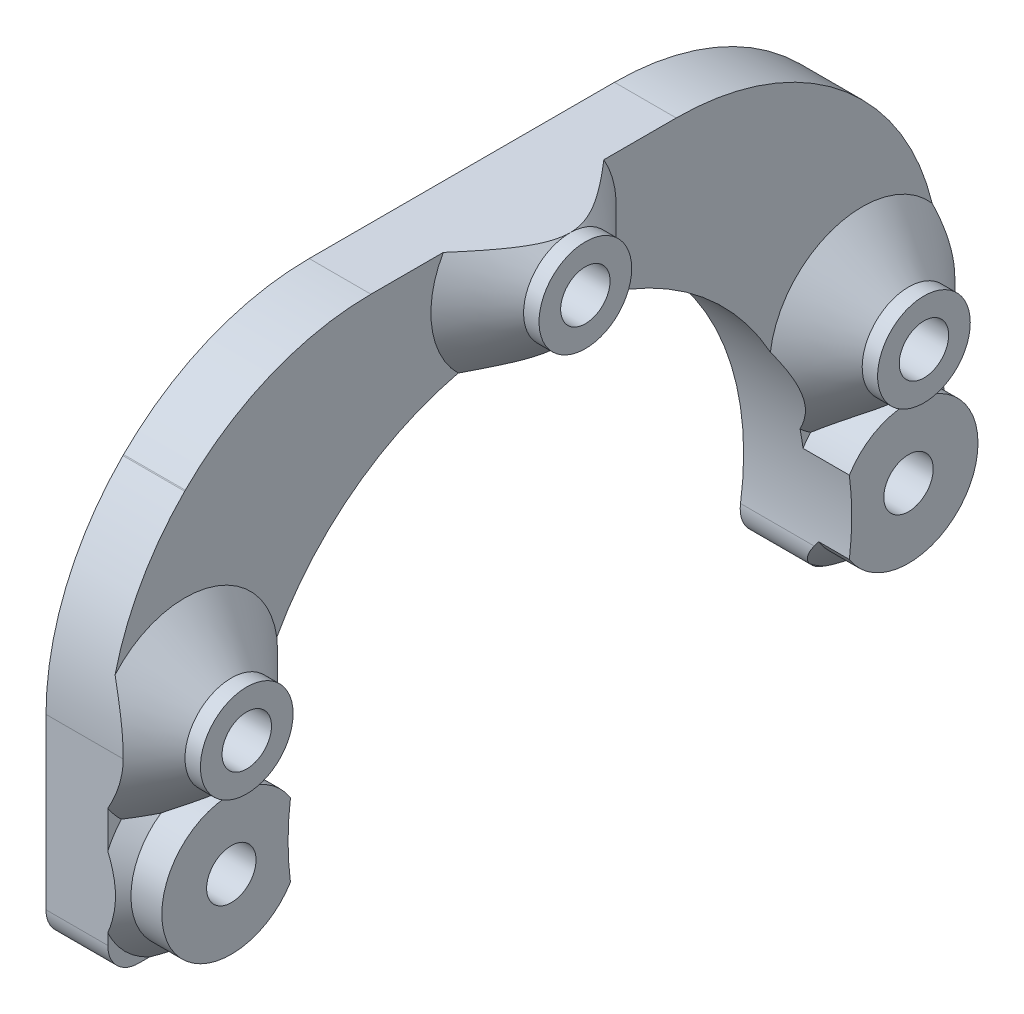
from build123d import *

# Parameters (mm, degrees)
SKETCH_1_W               = 53.85
SKETCH_1_H               = 30
SKETCH_1_R               = 1.6
EXTRUDE_1_DEPTH          = 4
SKETCH_7_R               = 4.5
SKETCH_7_R_2             = 1.6
EXTRUDE_3_DEPTH          = 3
CUT_EXTRUDE_1_DEPTH      = 62.772344136
CUT_EXTRUDE_1_DEPTH_BACK = 4
SKETCH_2_R               = 18.25
CHAMFER_1_SIZE           = 10
SKETCH_3_R               = 3
EXTRUDE_2_DEPTH          = 4
SKETCH_4_R               = 1.6
CUT_EXTRUDE_2_DEPTH      = 63.159653313
CHAMFER_3_SIZE           = 3
CHAMFER_4_SIZE           = 1
FILLET_1_R               = 2
FILLET_2_R               = 17


with BuildPart() as part:
    # 草图1 → 凸台-拉伸1 (new body)
    with BuildSketch(Plane(origin=(0, 0, 0), x_dir=(0, 0, -1), z_dir=(1, 0, 0))):
        with Locations((26.925, -15)):
            Rectangle(SKETCH_1_W, SKETCH_1_H)
        with Locations((5, -25)):
            Circle(SKETCH_1_R, mode=Mode.SUBTRACT)
        with Locations((48.85, -25)):
            Circle(SKETCH_1_R, mode=Mode.SUBTRACT)
    extrude(amount=EXTRUDE_1_DEPTH)

    # 草图7 → 凸台-拉伸3 (add)
    # profile 1 of 2: a face of its own
    with BuildSketch(Plane(origin=(4, 0, 0), x_dir=(0, 0, -1), z_dir=(1, 0, 0))):
        with Locations((5, -25)):
            Circle(SKETCH_7_R)
        with Locations((5, -25)):
            Circle(SKETCH_7_R_2, mode=Mode.SUBTRACT)
    # profile 2 of 2: a face of its own
    with BuildSketch(Plane(origin=(4, 0, 0), x_dir=(0, 0, -1), z_dir=(1, 0, 0))):
        with Locations((48.85, -25)):
            Circle(SKETCH_7_R)
        with Locations((48.85, -25)):
            Circle(SKETCH_7_R_2, mode=Mode.SUBTRACT)
    extrude(amount=EXTRUDE_3_DEPTH)

    # 草图2 → 切除-拉伸1 (cut, two sides: drawn at the far end of the back side and taken through both)
    with BuildSketch(Plane(origin=(4, 0, 0), x_dir=(0, 0, -1), z_dir=(1, 0, 0)).offset(-CUT_EXTRUDE_1_DEPTH_BACK)):
        with Locations((26.925, -25)):
            Circle(SKETCH_2_R)
    extrude(amount=CUT_EXTRUDE_1_DEPTH + CUT_EXTRUDE_1_DEPTH_BACK, mode=Mode.SUBTRACT)

    # 倒角1
    chamfer_1_edges = [part.edges().sort_by_distance(p)[0] for p in [
        (2, 0, 0),
        (2, 0, -53.85),
    ]]
    chamfer(chamfer_1_edges, length=CHAMFER_1_SIZE)

    # 草图3 → 凸台-拉伸2 (add)
    with BuildSketch(Plane(origin=(4, 0, 0), x_dir=(0, 0, -1), z_dir=(1, 0, 0))):
        with Locations((5, -17)):
            Circle(SKETCH_3_R)
        with Locations((48.85, -17)):
            Circle(SKETCH_3_R)
        with Locations(Location((26.925, -3, 0), (0, 0, 90))):
            Circle(SKETCH_3_R)
    extrude(amount=EXTRUDE_2_DEPTH)

    # 草图4 → 切除-拉伸2 (cut, through all)
    with BuildSketch(Plane(origin=(8, 0, 0), x_dir=(0, 0, -1), z_dir=(1, 0, 0))):
        with Locations((5, -17)):
            Circle(SKETCH_4_R)
        with Locations((48.85, -17)):
            Circle(SKETCH_4_R)
        with Locations((26.925, -3)):
            Circle(SKETCH_4_R)
    extrude(amount=-CUT_EXTRUDE_2_DEPTH, mode=Mode.SUBTRACT)

    # 倒角3
    # the kernel refuses this chamfer: 3 mm, written as the material it adds along each edge
    with BuildSketch(Plane(origin=(4, -17, -5), x_dir=(0, 0, -1), z_dir=(0, -1, 0))) as chamfer_3_piece_1_section:
        Polygon((3 + CHAMFER_3_SIZE, 0), (3, CHAMFER_3_SIZE), (3, 0), align=None)
    chamfer_3_piece_1 = revolve(axis=Axis((4, -17, -5), (1, 0, 0)), mode=Mode.PRIVATE)
    chamfer_3_piece_1 = split(chamfer_3_piece_1, bisect_by=Plane(origin=(5.467307701, -17, 0), z_dir=(0, 0, -1)), keep=Keep.TOP, mode=Mode.PRIVATE)
    chamfer_3_piece_1 = chamfer_3_piece_1 - Plane(origin=(5.467307701, -25, -26.925), x_dir=(0, 0, -1), z_dir=(1, 0, 0)) * Cylinder(18.25, 25, mode=Mode.PRIVATE)
    with BuildSketch(Plane(origin=(4, -17, -48.85), x_dir=(0, 0, -1), z_dir=(0, -1, 0))) as chamfer_3_piece_2_section:
        Polygon((3 + CHAMFER_3_SIZE, 0), (3, CHAMFER_3_SIZE), (3, 0), align=None)
    chamfer_3_piece_2 = revolve(axis=Axis((4, -17, -48.85), (1, 0, 0)), mode=Mode.PRIVATE)
    chamfer_3_piece_2 = chamfer_3_piece_2 - Plane(origin=(5.467307729, -25, -26.925), x_dir=(0, 0, -1), z_dir=(1, 0, 0)) * Cylinder(18.25, 24, mode=Mode.PRIVATE)
    chamfer_3_piece_2 = split(chamfer_3_piece_2, bisect_by=Plane(origin=(5.467307729, -17, -53.85), z_dir=(0, 0, 1)), keep=Keep.TOP, mode=Mode.PRIVATE)
    with BuildSketch(Plane(origin=(4, -3, -26.925), x_dir=(0, 1, 0), z_dir=(0, 0, -1))) as chamfer_3_piece_3_section:
        Polygon((3 + CHAMFER_3_SIZE, 0), (3, CHAMFER_3_SIZE), (3, 0), align=None)
    chamfer_3_piece_3 = revolve(axis=Axis((4, -3, -26.925), (1, 0, 0)), mode=Mode.PRIVATE)
    chamfer_3_piece_3 = split(chamfer_3_piece_3, bisect_by=Plane(origin=(4.469931391, 0, -22.187900458), z_dir=(0, -1, 0)), keep=Keep.TOP, mode=Mode.PRIVATE)
    chamfer_3_piece_3 = chamfer_3_piece_3 - Plane(origin=(4.469931391, -25, -26.925), x_dir=(0, 0, -1), z_dir=(1, 0, 0)) * Cylinder(18.25, 24, mode=Mode.PRIVATE)
    add([chamfer_3_piece_1, chamfer_3_piece_2, chamfer_3_piece_3])

    # 倒角4
    # the kernel refuses this chamfer: 1 mm, written as the material it adds along each edge
    with BuildSketch(Plane(origin=(4, -25, -48.85), x_dir=(0, 0.9653833924151701, -0.26083501614809607), z_dir=(0, 0.26083501614809607, 0.9653833924151701))) as chamfer_4_piece_1_section:
        Polygon((4.5, -CHAMFER_4_SIZE), (4.5 + CHAMFER_4_SIZE, 0), (4.5, 0), align=None)
    chamfer_4_piece_1 = revolve(axis=Axis((4, -25, -48.85), (-1, 0, 0)), revolution_arc=255.986755494, mode=Mode.PRIVATE)
    chamfer_4_piece_1 = chamfer_4_piece_1 - Plane(origin=(4.294296116, -25, -26.925), x_dir=(0, 0, -1), z_dir=(1, 0, 0)) * Cylinder(18.25, 22, mode=Mode.PRIVATE)
    chamfer_4_piece_1 = split(chamfer_4_piece_1, bisect_by=Plane(origin=(4.294296116, -30, -51.249638495), z_dir=(0, 1, 0)), keep=Keep.TOP, mode=Mode.PRIVATE)
    chamfer_4_piece_1 = split(chamfer_4_piece_1, bisect_by=Plane(origin=(4.294296116, -20.838072268, -53.85), z_dir=(0, 0, 1)), keep=Keep.TOP, mode=Mode.PRIVATE)
    add(chamfer_4_piece_1)
    with BuildSketch(Plane(origin=(4, -25, -5), x_dir=(0, 0.9653833924151692, 0.26083501614809945), z_dir=(0, 0.26083501614809945, -0.9653833924151692))) as chamfer_4_piece_2_section:
        Polygon((4.5, CHAMFER_4_SIZE), (4.5 + CHAMFER_4_SIZE, 0), (4.5, 0), align=None)
    chamfer_4_piece_2 = revolve(axis=Axis((4, -25, -5), (1, 0, 0)), revolution_arc=255.986755494, mode=Mode.PRIVATE)
    chamfer_4_piece_2 = chamfer_4_piece_2 - Plane(origin=(4.294296117, -25, -26.925), x_dir=(0, 0, -1), z_dir=(1, 0, 0)) * Cylinder(18.25, 22, mode=Mode.PRIVATE)
    chamfer_4_piece_2 = split(chamfer_4_piece_2, bisect_by=Plane(origin=(4.294296117, -30, -2.600361506), z_dir=(0, 1, 0)), keep=Keep.TOP, mode=Mode.PRIVATE)
    chamfer_4_piece_2 = split(chamfer_4_piece_2, bisect_by=Plane(origin=(4.294296117, -20.838072268, 0), z_dir=(0, 0, -1)), keep=Keep.TOP, mode=Mode.PRIVATE)
    add(chamfer_4_piece_2)

    # 圆角1
    # the kernel refuses this fillet: 2 mm, written as the material it takes off along each edge
    with BuildSketch(Plane(origin=(-6.187088914, -30, -9.373290682), x_dir=(0, 0, 1), z_dir=(1, 0, 0))) as fillet_1_piece_1:
        with BuildLine():
            CenterArc((2.474835566, -2), FILLET_1_R, 90, 98.519624254)
            ThreePointArc((0.496905207, -2.296296296), (0.285443162, -1.140143606), (0, 0))
            Line((0, 0), (2.474835566, 0))
        make_face()
    extrude(amount=16.374177829, mode=Mode.SUBTRACT)
    with BuildSketch(Plane(origin=(-6.187088914, -30, -44.476709318), x_dir=(0, 0.977378218113637, -0.21149898051057317), z_dir=(1, 0, 0))) as fillet_1_piece_2:
        with BuildLine():
            CenterArc((2.478181635, -1.995852414), FILLET_1_R, 93.690586551, 98.519624254)
            Line((0.523425199, -2.418850375), (0, 0))
            ThreePointArc((0, 0), (1.174722463, -0.037846719), (2.349444927, 0))
        make_face()
    extrude(amount=16.374177829, mode=Mode.SUBTRACT)
    with BuildSketch(Plane(origin=(-5, -30, -53.85), x_dir=(0, 0, 1), z_dir=(1, 0, 0)), Plane(origin=(-5, -30, 0), x_dir=(0, 1, 0), z_dir=(1, 0, 0))) as fillet_1_piece_3:
        with BuildLine():
            CenterArc((FILLET_1_R, -FILLET_1_R), FILLET_1_R, 90, 90)
            Line((0, -FILLET_1_R), (0, 0))
            Line((0, 0), (FILLET_1_R, 0))
        make_face()
    extrude(amount=14, mode=Mode.SUBTRACT)

    # 圆角2
    # the kernel refuses this fillet: 17 mm, written as the material it takes off along each edge
    with BuildSketch(Plane(origin=(-17.604076401, -10, -53.85), x_dir=(0, -1, 0), z_dir=(1, 0, 0))) as fillet_2_piece_1:
        with BuildLine():
            CenterArc((FILLET_2_R * 0.414213562373, -FILLET_2_R), FILLET_2_R, 90, 45)
            Line((-FILLET_2_R * 0.292893218813, -FILLET_2_R * 0.292893218813), (0, 0))
            Line((0, 0), (FILLET_2_R * 0.414213562373, 0))
        make_face()
    extrude(amount=39.208152802, mode=Mode.SUBTRACT)
    with BuildSketch(Plane(origin=(-17.604076401, 0, -43.85), x_dir=(0, 0, 1), z_dir=(1, 0, 0)), Plane(origin=(-17.604076401, -10, 0), x_dir=(0, -1, 0), z_dir=(1, 0, 0)), Plane(origin=(-17.604076401, 0, -10), x_dir=(0, -0.7071067811865477, 0.7071067811865474), z_dir=(1, 0, 0))) as fillet_2_piece_2:
        with BuildLine():
            CenterArc((FILLET_2_R * 0.414213562373, FILLET_2_R), FILLET_2_R, 225, 45)
            Line((-FILLET_2_R * 0.292893218813, FILLET_2_R * 0.292893218813), (0, 0))
            Line((0, 0), (FILLET_2_R * 0.414213562373, 0))
        make_face()
    extrude(amount=39.208152802, mode=Mode.SUBTRACT)


solid = part.part
